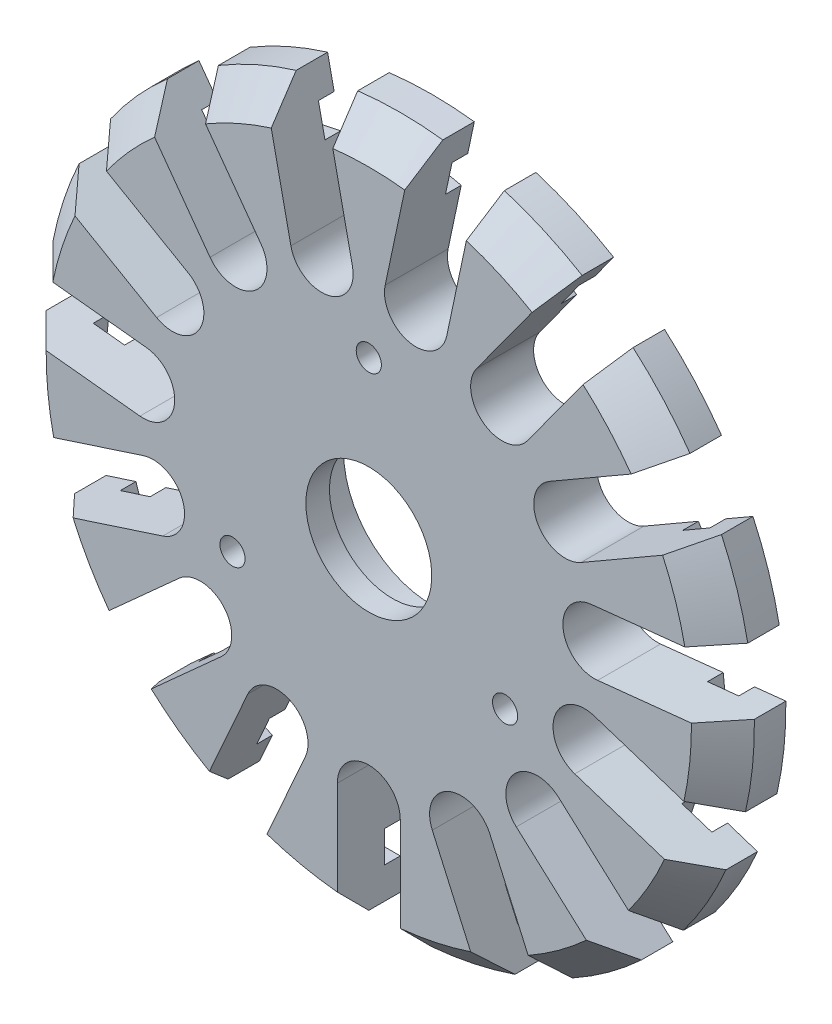
from build123d import *

# Parameters (mm, degrees)
ESBO_O1_R                               = 22.5
RESSALTO_EXTRUS_O1_DEPTH                = 4
CHANFRO1_SIZE                           = 2
CORTE_EXTRUS_O1_DEPTH                   = 33.070235422
ESBO_O3_R                               = 4
CORTE_EXTRUS_O2_DEPTH                   = 33.070235422
ESBO_O4_R                               = 5.6
CORTE_EXTRUS_O3_DEPTH                   = 2.5
PADR_OCIRCULAR1_COUNT                   = 15
ESBO_O11_W                              = 7
ESBO_O11_H                              = 2
CORTE_EXTRUS_O4_DEPTH                   = 1
PADR_OCIRCULAR3_COUNT                   = 15
BROCA_DE_ROSQUEAR_PARA_TARRAXA_DE_M21_D = 1.6
PADR_OCIRCULAR4_COUNT                   = 3


with BuildPart() as part:
    # Esboço1 → Ressalto-extrusão1 (new body)
    with BuildSketch(Plane.XY):
        Circle(ESBO_O1_R)
    extrude(amount=RESSALTO_EXTRUS_O1_DEPTH)

    # Chanfro1
    chanfro1_edges = [part.edges().sort_by_distance(p)[0] for p in [
        (-22.5, 0, 4),
    ]]
    chamfer(chanfro1_edges, length=CHANFRO1_SIZE)

    # Esboço2 → Corte-extrusão1 (cut, through all)
    with BuildSketch(Plane(origin=(0, 0, 0), x_dir=(-1, 0, 0), z_dir=(0, 0, -1))):
        with BuildLine():
            Line((2, -22.410934831), (2, -14.410934831))
            ThreePointArc((2, -14.410934831), (0, -12.410934831), (-2, -14.410934831))
            Line((-2, -14.410934831), (-2, -22.410934831))
            ThreePointArc((-2, -22.410934831), (0, -22.5), (2, -22.410934831))
        make_face()
    corte_extrus_o1 = extrude(amount=-CORTE_EXTRUS_O1_DEPTH, mode=Mode.SUBTRACT)

    # Esboço3 → Corte-extrusão2 (cut, through all)
    with BuildSketch(Plane(origin=(0, 0, 0), x_dir=(-1, 0, 0), z_dir=(0, 0, -1))):
        Circle(ESBO_O3_R)
    extrude(amount=-CORTE_EXTRUS_O2_DEPTH, mode=Mode.SUBTRACT)

    # Esboço4 → Corte-extrusão3 (cut)
    with BuildSketch(Plane(origin=(0, 0, 0), x_dir=(-1, 0, 0), z_dir=(0, 0, -1))):
        Circle(ESBO_O4_R)
    extrude(amount=-CORTE_EXTRUS_O3_DEPTH, mode=Mode.SUBTRACT)

    # PadrãoCircular1: Corte-extrusão1 ×15 about axis
    padr_ocircular1_axis = Axis((0, 0, 0), (0, 0, -1))
    for i in range(1, PADR_OCIRCULAR1_COUNT):
        add(corte_extrus_o1.rotate(padr_ocircular1_axis, i * 360 / PADR_OCIRCULAR1_COUNT), mode=Mode.SUBTRACT)

    # Esboço11 → Corte-extrusão4 (cut)
    with BuildSketch(Plane(origin=(0, 0, 0), x_dir=(-1, 0, 0), z_dir=(0, 0, -1))):
        with Locations((0, -19.410934831)):
            Rectangle(ESBO_O11_W, ESBO_O11_H)
    corte_extrus_o4 = extrude(amount=-CORTE_EXTRUS_O4_DEPTH, mode=Mode.SUBTRACT)

    # PadrãoCircular3: Corte-extrusão4 ×15 about axis
    padr_ocircular3_axis = Axis((0, 0, 0), (0, 0, -1))
    for i in range(1, PADR_OCIRCULAR3_COUNT):
        add(corte_extrus_o4.rotate(padr_ocircular3_axis, i * 360 / PADR_OCIRCULAR3_COUNT), mode=Mode.SUBTRACT)

    # Broca de rosquear para tarraxa de M21 (through all)
    with Locations(Plane(origin=(0, 10, 0), x_dir=(-1, 0, 0), z_dir=(0, 0, -1))):
        with Locations((0, 0)):
            broca_de_rosquear_para_tarraxa_de_m21 = Hole(BROCA_DE_ROSQUEAR_PARA_TARRAXA_DE_M21_D / 2)

    # PadrãoCircular4: Broca de rosquear para tarraxa de M21 ×3 about axis
    padr_ocircular4_axis = Axis((0, 0, 0), (0, 0, -1))
    for i in range(1, PADR_OCIRCULAR4_COUNT):
        add(broca_de_rosquear_para_tarraxa_de_m21.rotate(padr_ocircular4_axis, i * 360 / PADR_OCIRCULAR4_COUNT), mode=Mode.SUBTRACT)


solid = part.part
